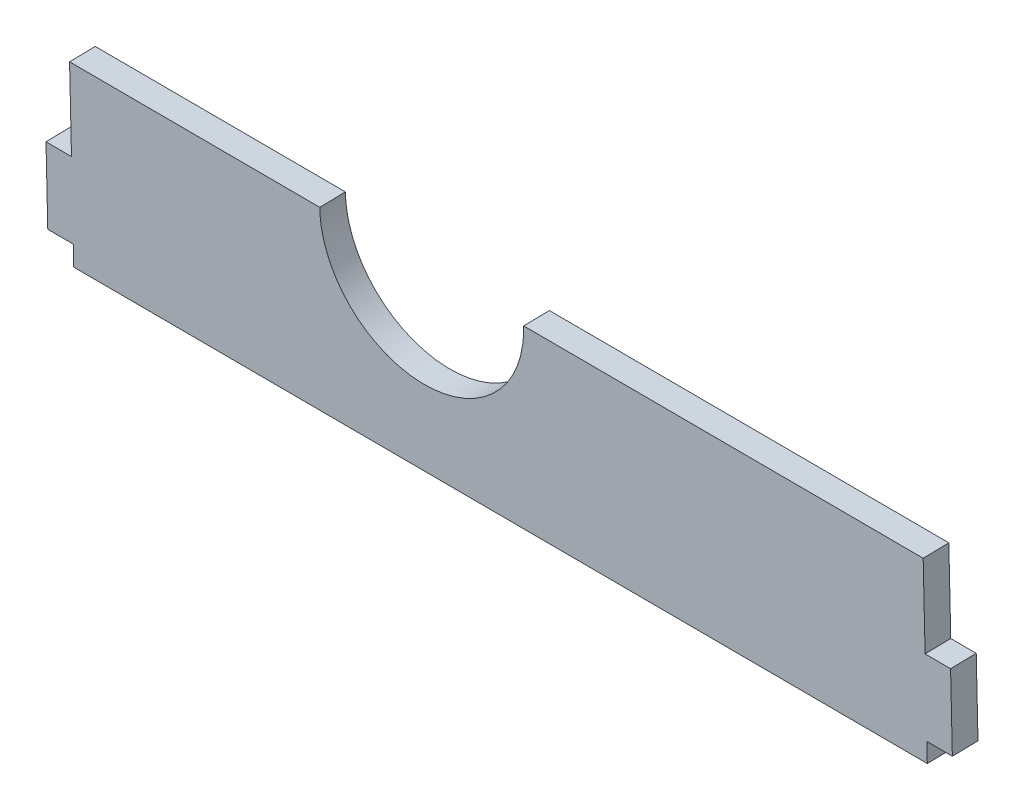
from build123d import *

# Parameters (mm, degrees)
BOSS_EXTRUDE1_DEPTH = 6.35


with BuildPart() as part:
    # Sketch1 → Boss-Extrude1 (new body)
    with BuildSketch(Plane(origin=(-0.338050957, -2.166981544, 94.101832391), x_dir=(0.9999935508312615, -8.268146807303254e-05, 0.0035904678887610894), z_dir=(-0.0035914197590071846, -0.023021796502325245, 0.9997285124422131))):
        with BuildLine():
            Line((236.877078617, -28.11878027), (243.227078617, -28.11878027))
            Line((243.227078617, -28.11878027), (243.227078617, -33.122710711))
            Line((243.227078617, -33.122710711), (455.95107602, -33.122710711))
            Line((455.95107602, -33.122710711), (455.95107602, -28.298303458))
            Line((455.95107602, -28.298303458), (462.301838068, -28.298303458))
            Line((462.301838068, -28.298303458), (462.301838068, -9.248303458))
            Line((462.301838068, -9.248303458), (455.951838068, -9.248303458))
            Line((455.951838068, -9.248303458), (455.952670896, 11.571066175))
            Line((455.952670896, 11.571066175), (356.413957438, 11.566336687))
            add(Edge.make_bspline(
                [(356.413957438, 11.566336687), (356.413154179, 10.230187882), (356.307050724, 8.928363908), (356.110746239, 7.669666942)],
                knots=[0.928343353, 0.928343353, 0.928343353, 0.928343353, 1, 1, 1, 1], degree=3, weights=[0.866956056, 0.907880921, 0.952228902, 1]))
            Line((356.110746239, 7.669666942), (356.069707191, 7.406526111))
            add(Edge.make_bspline(
                [(356.069707191, 7.406526111), (349.645197224, -33.787190013), (305.128556412, -35.346859606), (305.574396885, 11.563921094)],
                knots=[0, 0, 0, 0, 0.932216201, 0.932216201, 0.932216201, 0.932216201], degree=3, weights=[1, 0.378522533, 0.336396429, 0.873621689]))
            Line((305.574396885, 11.563921094), (243.227078617, 11.56095872))
            Line((243.227078617, 11.56095872), (243.227078617, -9.06878027))
            Line((243.227078617, -9.06878027), (236.877078617, -9.06878027))
            Line((236.877078617, -9.06878027), (236.877078617, -28.11878027))
        make_face()
    extrude(amount=BOSS_EXTRUDE1_DEPTH)


solid = part.part
